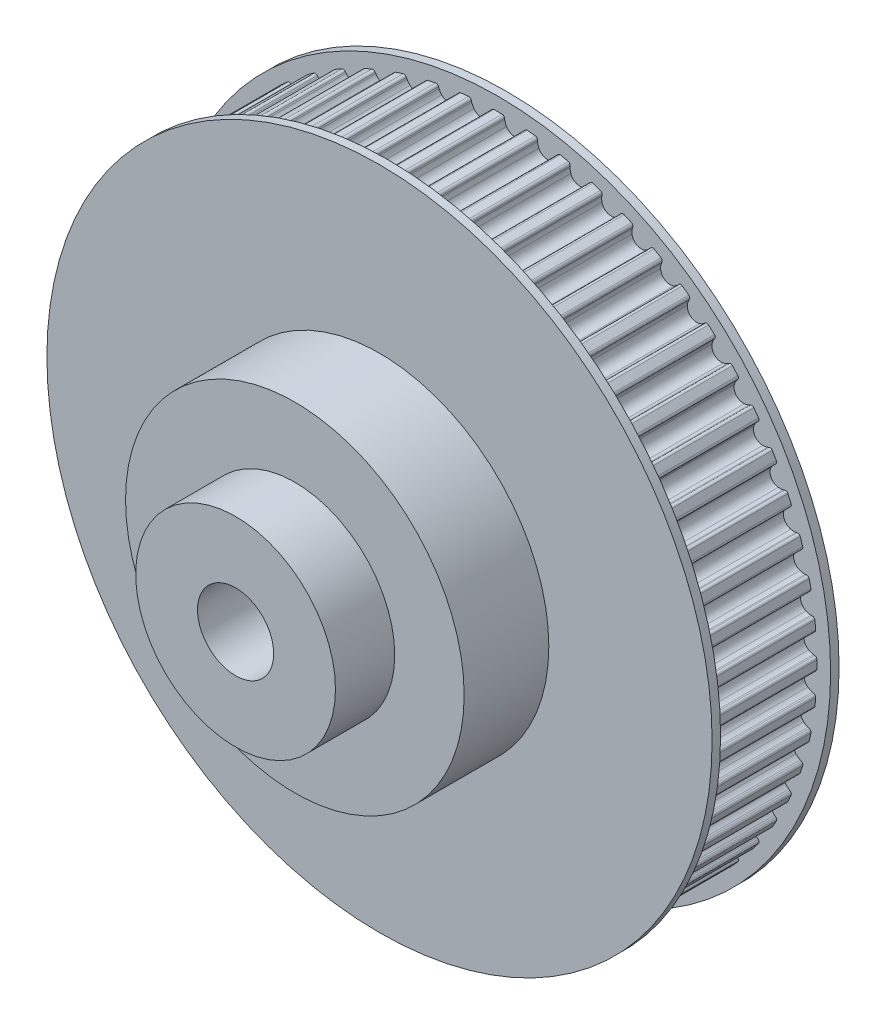
from build123d import *

# Parameters (mm, degrees)
BOSS_EXTRUDE1_DEPTH          = 6.5
CIRPATTERN1_COUNT            = 60
SKETCH2_R                    = 18.094593171
BOSS_EXTRUDE2_DEPTH          = 6.5
SCHIZZO1_R                   = 19.644593171
ESTRUSIONE_ESTRUSIONE1_DEPTH = 0.5
SCHIZZO2_R                   = 5.9
ESTRUSIONE_ESTRUSIONE2_DEPTH = 8.5
SCHIZZO3_R                   = 2.25
TAGLIO_ESTRUSIONE1_DEPTH     = 33.059633212
SCHIZZO5_R                   = 5
TAGLIO_ESTRUSIONE2_DEPTH     = 3
SCHIZZO6_R                   = 10
ESTRUSIONE_ESTRUSIONE3_DEPTH = 5


with BuildPart() as part:
    # Sketch1 → Boss-Extrude1 (new body)
    with BuildSketch(Plane.XY):
        with BuildLine():
            ThreePointArc((0.946997836, 18.06979516), (0.687371511, 18.150016593), (0.496947281, 18.343872002))
            ThreePointArc((0.496947281, 18.343872002), (0.433235579, 18.479360342), (0.394691521, 18.624034552))
            ThreePointArc((0.394691521, 18.624034552), (0.388491687, 18.66504517), (0.3839978, 18.706277606))
            ThreePointArc((0.3839978, 18.706277606), (0.336575775, 18.803103309), (0.236458035, 18.8431096))
            ThreePointArc((0.236458035, 18.8431096), (0, 18.844593171), (-0.236458035, 18.8431096))
            ThreePointArc((-0.236458035, 18.8431096), (-0.336575775, 18.803103309), (-0.3839978, 18.706277606))
            ThreePointArc((-0.3839978, 18.706277606), (-0.388491687, 18.66504517), (-0.394691521, 18.624034552))
            ThreePointArc((-0.394691521, 18.624034552), (-0.433235579, 18.479360342), (-0.496947281, 18.343872002))
            ThreePointArc((-0.496947281, 18.343872002), (-0.687371511, 18.150016593), (-0.946997836, 18.06979516))
            ThreePointArc((-0.946997836, 18.06979516), (0, 18.094593171), (0.946997836, 18.06979516))
        make_face()
    extrude(amount=BOSS_EXTRUDE1_DEPTH)


with BuildPart() as cirpattern1_1:
    # CirPattern1: pattern copy
    add(part.part.rotate(Axis((0, 0, 0), (0, 0, 1)), 1 * 360 / CIRPATTERN1_COUNT))


with BuildPart() as cirpattern1_2:
    # CirPattern1: pattern copy
    add(part.part.rotate(Axis((0, 0, 0), (0, 0, 1)), 2 * 360 / CIRPATTERN1_COUNT))


with BuildPart() as cirpattern1_3:
    # CirPattern1: pattern copy
    add(part.part.rotate(Axis((0, 0, 0), (0, 0, 1)), 3 * 360 / CIRPATTERN1_COUNT))


with BuildPart() as cirpattern1_4:
    # CirPattern1: pattern copy
    add(part.part.rotate(Axis((0, 0, 0), (0, 0, 1)), 4 * 360 / CIRPATTERN1_COUNT))


with BuildPart() as cirpattern1_5:
    # CirPattern1: pattern copy
    add(part.part.rotate(Axis((0, 0, 0), (0, 0, 1)), 5 * 360 / CIRPATTERN1_COUNT))


with BuildPart() as cirpattern1_6:
    # CirPattern1: pattern copy
    add(part.part.rotate(Axis((0, 0, 0), (0, 0, 1)), 6 * 360 / CIRPATTERN1_COUNT))


with BuildPart() as cirpattern1_7:
    # CirPattern1: pattern copy
    add(part.part.rotate(Axis((0, 0, 0), (0, 0, 1)), 7 * 360 / CIRPATTERN1_COUNT))


with BuildPart() as cirpattern1_8:
    # CirPattern1: pattern copy
    add(part.part.rotate(Axis((0, 0, 0), (0, 0, 1)), 8 * 360 / CIRPATTERN1_COUNT))


with BuildPart() as cirpattern1_9:
    # CirPattern1: pattern copy
    add(part.part.rotate(Axis((0, 0, 0), (0, 0, 1)), 9 * 360 / CIRPATTERN1_COUNT))


with BuildPart() as cirpattern1_10:
    # CirPattern1: pattern copy
    add(part.part.rotate(Axis((0, 0, 0), (0, 0, 1)), 10 * 360 / CIRPATTERN1_COUNT))


with BuildPart() as cirpattern1_11:
    # CirPattern1: pattern copy
    add(part.part.rotate(Axis((0, 0, 0), (0, 0, 1)), 11 * 360 / CIRPATTERN1_COUNT))


with BuildPart() as cirpattern1_12:
    # CirPattern1: pattern copy
    add(part.part.rotate(Axis((0, 0, 0), (0, 0, 1)), 12 * 360 / CIRPATTERN1_COUNT))


with BuildPart() as cirpattern1_13:
    # CirPattern1: pattern copy
    add(part.part.rotate(Axis((0, 0, 0), (0, 0, 1)), 13 * 360 / CIRPATTERN1_COUNT))


with BuildPart() as cirpattern1_14:
    # CirPattern1: pattern copy
    add(part.part.rotate(Axis((0, 0, 0), (0, 0, 1)), 14 * 360 / CIRPATTERN1_COUNT))


with BuildPart() as cirpattern1_15:
    # CirPattern1: pattern copy
    add(part.part.rotate(Axis((0, 0, 0), (0, 0, 1)), 15 * 360 / CIRPATTERN1_COUNT))


with BuildPart() as cirpattern1_16:
    # CirPattern1: pattern copy
    add(part.part.rotate(Axis((0, 0, 0), (0, 0, 1)), 16 * 360 / CIRPATTERN1_COUNT))


with BuildPart() as cirpattern1_17:
    # CirPattern1: pattern copy
    add(part.part.rotate(Axis((0, 0, 0), (0, 0, 1)), 17 * 360 / CIRPATTERN1_COUNT))


with BuildPart() as cirpattern1_18:
    # CirPattern1: pattern copy
    add(part.part.rotate(Axis((0, 0, 0), (0, 0, 1)), 18 * 360 / CIRPATTERN1_COUNT))


with BuildPart() as cirpattern1_19:
    # CirPattern1: pattern copy
    add(part.part.rotate(Axis((0, 0, 0), (0, 0, 1)), 19 * 360 / CIRPATTERN1_COUNT))


with BuildPart() as cirpattern1_20:
    # CirPattern1: pattern copy
    add(part.part.rotate(Axis((0, 0, 0), (0, 0, 1)), 20 * 360 / CIRPATTERN1_COUNT))


with BuildPart() as cirpattern1_21:
    # CirPattern1: pattern copy
    add(part.part.rotate(Axis((0, 0, 0), (0, 0, 1)), 21 * 360 / CIRPATTERN1_COUNT))


with BuildPart() as cirpattern1_22:
    # CirPattern1: pattern copy
    add(part.part.rotate(Axis((0, 0, 0), (0, 0, 1)), 22 * 360 / CIRPATTERN1_COUNT))


with BuildPart() as cirpattern1_23:
    # CirPattern1: pattern copy
    add(part.part.rotate(Axis((0, 0, 0), (0, 0, 1)), 23 * 360 / CIRPATTERN1_COUNT))


with BuildPart() as cirpattern1_24:
    # CirPattern1: pattern copy
    add(part.part.rotate(Axis((0, 0, 0), (0, 0, 1)), 24 * 360 / CIRPATTERN1_COUNT))


with BuildPart() as cirpattern1_25:
    # CirPattern1: pattern copy
    add(part.part.rotate(Axis((0, 0, 0), (0, 0, 1)), 25 * 360 / CIRPATTERN1_COUNT))


with BuildPart() as cirpattern1_26:
    # CirPattern1: pattern copy
    add(part.part.rotate(Axis((0, 0, 0), (0, 0, 1)), 26 * 360 / CIRPATTERN1_COUNT))


with BuildPart() as cirpattern1_27:
    # CirPattern1: pattern copy
    add(part.part.rotate(Axis((0, 0, 0), (0, 0, 1)), 27 * 360 / CIRPATTERN1_COUNT))


with BuildPart() as cirpattern1_28:
    # CirPattern1: pattern copy
    add(part.part.rotate(Axis((0, 0, 0), (0, 0, 1)), 28 * 360 / CIRPATTERN1_COUNT))


with BuildPart() as cirpattern1_29:
    # CirPattern1: pattern copy
    add(part.part.rotate(Axis((0, 0, 0), (0, 0, 1)), 29 * 360 / CIRPATTERN1_COUNT))


with BuildPart() as cirpattern1_30:
    # CirPattern1: pattern copy
    add(part.part.rotate(Axis((0, 0, 0), (0, 0, 1)), 30 * 360 / CIRPATTERN1_COUNT))


with BuildPart() as cirpattern1_31:
    # CirPattern1: pattern copy
    add(part.part.rotate(Axis((0, 0, 0), (0, 0, 1)), 31 * 360 / CIRPATTERN1_COUNT))


with BuildPart() as cirpattern1_32:
    # CirPattern1: pattern copy
    add(part.part.rotate(Axis((0, 0, 0), (0, 0, 1)), 32 * 360 / CIRPATTERN1_COUNT))


with BuildPart() as cirpattern1_33:
    # CirPattern1: pattern copy
    add(part.part.rotate(Axis((0, 0, 0), (0, 0, 1)), 33 * 360 / CIRPATTERN1_COUNT))


with BuildPart() as cirpattern1_34:
    # CirPattern1: pattern copy
    add(part.part.rotate(Axis((0, 0, 0), (0, 0, 1)), 34 * 360 / CIRPATTERN1_COUNT))


with BuildPart() as cirpattern1_35:
    # CirPattern1: pattern copy
    add(part.part.rotate(Axis((0, 0, 0), (0, 0, 1)), 35 * 360 / CIRPATTERN1_COUNT))


with BuildPart() as cirpattern1_36:
    # CirPattern1: pattern copy
    add(part.part.rotate(Axis((0, 0, 0), (0, 0, 1)), 36 * 360 / CIRPATTERN1_COUNT))


with BuildPart() as cirpattern1_37:
    # CirPattern1: pattern copy
    add(part.part.rotate(Axis((0, 0, 0), (0, 0, 1)), 37 * 360 / CIRPATTERN1_COUNT))


with BuildPart() as cirpattern1_38:
    # CirPattern1: pattern copy
    add(part.part.rotate(Axis((0, 0, 0), (0, 0, 1)), 38 * 360 / CIRPATTERN1_COUNT))


with BuildPart() as cirpattern1_39:
    # CirPattern1: pattern copy
    add(part.part.rotate(Axis((0, 0, 0), (0, 0, 1)), 39 * 360 / CIRPATTERN1_COUNT))


with BuildPart() as cirpattern1_40:
    # CirPattern1: pattern copy
    add(part.part.rotate(Axis((0, 0, 0), (0, 0, 1)), 40 * 360 / CIRPATTERN1_COUNT))


with BuildPart() as cirpattern1_41:
    # CirPattern1: pattern copy
    add(part.part.rotate(Axis((0, 0, 0), (0, 0, 1)), 41 * 360 / CIRPATTERN1_COUNT))


with BuildPart() as cirpattern1_42:
    # CirPattern1: pattern copy
    add(part.part.rotate(Axis((0, 0, 0), (0, 0, 1)), 42 * 360 / CIRPATTERN1_COUNT))


with BuildPart() as cirpattern1_43:
    # CirPattern1: pattern copy
    add(part.part.rotate(Axis((0, 0, 0), (0, 0, 1)), 43 * 360 / CIRPATTERN1_COUNT))


with BuildPart() as cirpattern1_44:
    # CirPattern1: pattern copy
    add(part.part.rotate(Axis((0, 0, 0), (0, 0, 1)), 44 * 360 / CIRPATTERN1_COUNT))


with BuildPart() as cirpattern1_45:
    # CirPattern1: pattern copy
    add(part.part.rotate(Axis((0, 0, 0), (0, 0, 1)), 45 * 360 / CIRPATTERN1_COUNT))


with BuildPart() as cirpattern1_46:
    # CirPattern1: pattern copy
    add(part.part.rotate(Axis((0, 0, 0), (0, 0, 1)), 46 * 360 / CIRPATTERN1_COUNT))


with BuildPart() as cirpattern1_47:
    # CirPattern1: pattern copy
    add(part.part.rotate(Axis((0, 0, 0), (0, 0, 1)), 47 * 360 / CIRPATTERN1_COUNT))


with BuildPart() as cirpattern1_48:
    # CirPattern1: pattern copy
    add(part.part.rotate(Axis((0, 0, 0), (0, 0, 1)), 48 * 360 / CIRPATTERN1_COUNT))


with BuildPart() as cirpattern1_49:
    # CirPattern1: pattern copy
    add(part.part.rotate(Axis((0, 0, 0), (0, 0, 1)), 49 * 360 / CIRPATTERN1_COUNT))


with BuildPart() as cirpattern1_50:
    # CirPattern1: pattern copy
    add(part.part.rotate(Axis((0, 0, 0), (0, 0, 1)), 50 * 360 / CIRPATTERN1_COUNT))


with BuildPart() as cirpattern1_51:
    # CirPattern1: pattern copy
    add(part.part.rotate(Axis((0, 0, 0), (0, 0, 1)), 51 * 360 / CIRPATTERN1_COUNT))


with BuildPart() as cirpattern1_52:
    # CirPattern1: pattern copy
    add(part.part.rotate(Axis((0, 0, 0), (0, 0, 1)), 52 * 360 / CIRPATTERN1_COUNT))


with BuildPart() as cirpattern1_53:
    # CirPattern1: pattern copy
    add(part.part.rotate(Axis((0, 0, 0), (0, 0, 1)), 53 * 360 / CIRPATTERN1_COUNT))


with BuildPart() as cirpattern1_54:
    # CirPattern1: pattern copy
    add(part.part.rotate(Axis((0, 0, 0), (0, 0, 1)), 54 * 360 / CIRPATTERN1_COUNT))


with BuildPart() as cirpattern1_55:
    # CirPattern1: pattern copy
    add(part.part.rotate(Axis((0, 0, 0), (0, 0, 1)), 55 * 360 / CIRPATTERN1_COUNT))


with BuildPart() as cirpattern1_56:
    # CirPattern1: pattern copy
    add(part.part.rotate(Axis((0, 0, 0), (0, 0, 1)), 56 * 360 / CIRPATTERN1_COUNT))


with BuildPart() as cirpattern1_57:
    # CirPattern1: pattern copy
    add(part.part.rotate(Axis((0, 0, 0), (0, 0, 1)), 57 * 360 / CIRPATTERN1_COUNT))


with BuildPart() as cirpattern1_58:
    # CirPattern1: pattern copy
    add(part.part.rotate(Axis((0, 0, 0), (0, 0, 1)), 58 * 360 / CIRPATTERN1_COUNT))


with BuildPart() as cirpattern1_59:
    # CirPattern1: pattern copy
    add(part.part.rotate(Axis((0, 0, 0), (0, 0, 1)), 59 * 360 / CIRPATTERN1_COUNT))


with BuildPart() as part_1:
    add(part.part)

    add(cirpattern1_1.part)  # Boss-Extrude2 merges CirPattern1_1

    add(cirpattern1_2.part)  # Boss-Extrude2 merges CirPattern1_2

    add(cirpattern1_3.part)  # Boss-Extrude2 merges CirPattern1_3

    add(cirpattern1_4.part)  # Boss-Extrude2 merges CirPattern1_4

    add(cirpattern1_5.part)  # Boss-Extrude2 merges CirPattern1_5

    add(cirpattern1_6.part)  # Boss-Extrude2 merges CirPattern1_6

    add(cirpattern1_7.part)  # Boss-Extrude2 merges CirPattern1_7

    add(cirpattern1_8.part)  # Boss-Extrude2 merges CirPattern1_8

    add(cirpattern1_9.part)  # Boss-Extrude2 merges CirPattern1_9

    add(cirpattern1_10.part)  # Boss-Extrude2 merges CirPattern1_10

    add(cirpattern1_11.part)  # Boss-Extrude2 merges CirPattern1_11

    add(cirpattern1_12.part)  # Boss-Extrude2 merges CirPattern1_12

    add(cirpattern1_13.part)  # Boss-Extrude2 merges CirPattern1_13

    add(cirpattern1_14.part)  # Boss-Extrude2 merges CirPattern1_14

    add(cirpattern1_15.part)  # Boss-Extrude2 merges CirPattern1_15

    add(cirpattern1_16.part)  # Boss-Extrude2 merges CirPattern1_16

    add(cirpattern1_17.part)  # Boss-Extrude2 merges CirPattern1_17

    add(cirpattern1_18.part)  # Boss-Extrude2 merges CirPattern1_18

    add(cirpattern1_19.part)  # Boss-Extrude2 merges CirPattern1_19

    add(cirpattern1_20.part)  # Boss-Extrude2 merges CirPattern1_20

    add(cirpattern1_21.part)  # Boss-Extrude2 merges CirPattern1_21

    add(cirpattern1_22.part)  # Boss-Extrude2 merges CirPattern1_22

    add(cirpattern1_23.part)  # Boss-Extrude2 merges CirPattern1_23

    add(cirpattern1_24.part)  # Boss-Extrude2 merges CirPattern1_24

    add(cirpattern1_25.part)  # Boss-Extrude2 merges CirPattern1_25

    add(cirpattern1_26.part)  # Boss-Extrude2 merges CirPattern1_26

    add(cirpattern1_27.part)  # Boss-Extrude2 merges CirPattern1_27

    add(cirpattern1_28.part)  # Boss-Extrude2 merges CirPattern1_28

    add(cirpattern1_29.part)  # Boss-Extrude2 merges CirPattern1_29

    add(cirpattern1_30.part)  # Boss-Extrude2 merges CirPattern1_30

    add(cirpattern1_31.part)  # Boss-Extrude2 merges CirPattern1_31

    add(cirpattern1_32.part)  # Boss-Extrude2 merges CirPattern1_32

    add(cirpattern1_33.part)  # Boss-Extrude2 merges CirPattern1_33

    add(cirpattern1_34.part)  # Boss-Extrude2 merges CirPattern1_34

    add(cirpattern1_35.part)  # Boss-Extrude2 merges CirPattern1_35

    add(cirpattern1_36.part)  # Boss-Extrude2 merges CirPattern1_36

    add(cirpattern1_37.part)  # Boss-Extrude2 merges CirPattern1_37

    add(cirpattern1_38.part)  # Boss-Extrude2 merges CirPattern1_38

    add(cirpattern1_39.part)  # Boss-Extrude2 merges CirPattern1_39

    add(cirpattern1_40.part)  # Boss-Extrude2 merges CirPattern1_40

    add(cirpattern1_41.part)  # Boss-Extrude2 merges CirPattern1_41

    add(cirpattern1_42.part)  # Boss-Extrude2 merges CirPattern1_42

    add(cirpattern1_43.part)  # Boss-Extrude2 merges CirPattern1_43

    add(cirpattern1_44.part)  # Boss-Extrude2 merges CirPattern1_44

    add(cirpattern1_45.part)  # Boss-Extrude2 merges CirPattern1_45

    add(cirpattern1_46.part)  # Boss-Extrude2 merges CirPattern1_46

    add(cirpattern1_47.part)  # Boss-Extrude2 merges CirPattern1_47

    add(cirpattern1_48.part)  # Boss-Extrude2 merges CirPattern1_48

    add(cirpattern1_49.part)  # Boss-Extrude2 merges CirPattern1_49

    add(cirpattern1_50.part)  # Boss-Extrude2 merges CirPattern1_50

    add(cirpattern1_51.part)  # Boss-Extrude2 merges CirPattern1_51

    add(cirpattern1_52.part)  # Boss-Extrude2 merges CirPattern1_52

    add(cirpattern1_53.part)  # Boss-Extrude2 merges CirPattern1_53

    add(cirpattern1_54.part)  # Boss-Extrude2 merges CirPattern1_54

    add(cirpattern1_55.part)  # Boss-Extrude2 merges CirPattern1_55

    add(cirpattern1_56.part)  # Boss-Extrude2 merges CirPattern1_56

    add(cirpattern1_57.part)  # Boss-Extrude2 merges CirPattern1_57

    add(cirpattern1_58.part)  # Boss-Extrude2 merges CirPattern1_58

    add(cirpattern1_59.part)  # Boss-Extrude2 merges CirPattern1_59
    # Sketch2 → Boss-Extrude2 (add)
    with BuildSketch(Plane(origin=(0, 0, 0), x_dir=(-1, 0, 0), z_dir=(0, 0, -1))):
        Circle(SKETCH2_R)
    extrude(amount=-BOSS_EXTRUDE2_DEPTH)

    # Schizzo1 → Estrusione-Estrusione1 (add)
    with BuildSketch(Plane.XY.offset(6.5)):
        Circle(SCHIZZO1_R)
    estrusione_estrusione1 = extrude(amount=ESTRUSIONE_ESTRUSIONE1_DEPTH)

    # Specchia1: Estrusione-Estrusione1 across plane
    add(estrusione_estrusione1.mirror(Plane(origin=(0, 0, 3.25), x_dir=(1, 0, 0), z_dir=(0, 0, -1))))

    # Schizzo2 → Estrusione-Estrusione2 (add)
    with BuildSketch(Plane.XY.offset(7)):
        Circle(SCHIZZO2_R)
    extrude(amount=ESTRUSIONE_ESTRUSIONE2_DEPTH)

    # Schizzo3 → Taglio-Estrusione1 (cut, through all)
    with BuildSketch(Plane(origin=(0, 0, -0.5), x_dir=(-1, 0, 0), z_dir=(0, 0, -1))):
        Circle(SCHIZZO3_R)
    extrude(amount=-TAGLIO_ESTRUSIONE1_DEPTH, mode=Mode.SUBTRACT)

    # Schizzo5 → Taglio-Estrusione2 (cut)
    with BuildSketch(Plane(origin=(0, 0, -0.5), x_dir=(-1, 0, 0), z_dir=(0, 0, -1))):
        Circle(SCHIZZO5_R)
    extrude(amount=-TAGLIO_ESTRUSIONE2_DEPTH, mode=Mode.SUBTRACT)

    # Schizzo6 → Estrusione-Estrusione3 (add)
    with BuildSketch(Plane.XY.offset(7)):
        Circle(SCHIZZO6_R)
    extrude(amount=ESTRUSIONE_ESTRUSIONE3_DEPTH)


solid = part_1.part
